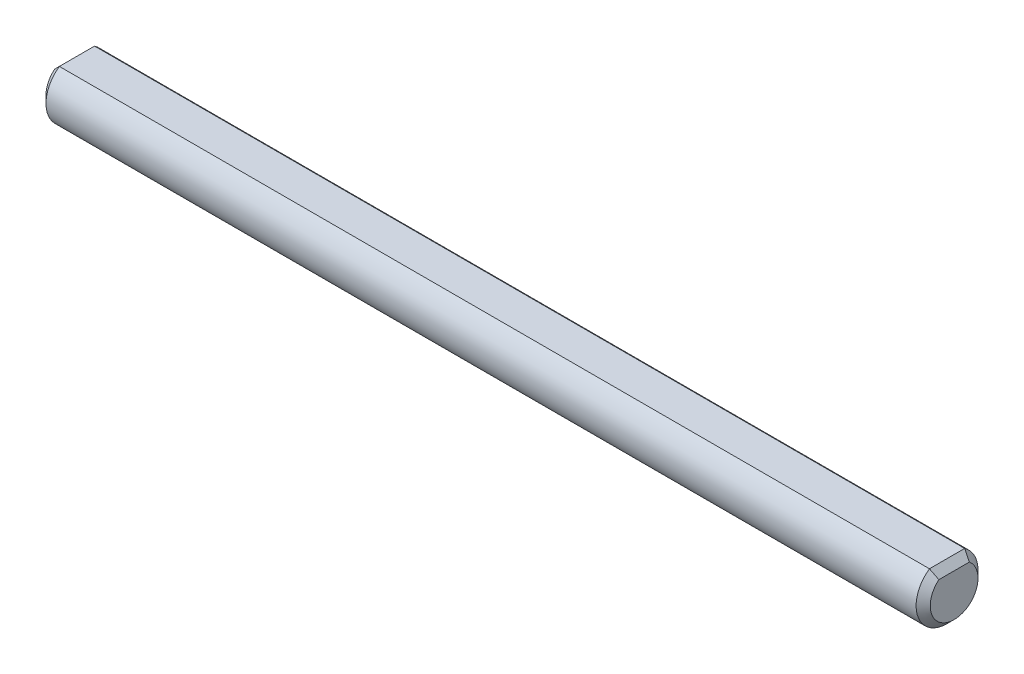
from build123d import *

# Parameters (mm, degrees)
BOSS_EXTRUDE1_DEPTH = 25
CHAMFER1_SIZE       = 0.4


with BuildPart() as part:
    # Sketch1 → Boss-Extrude1 (new, symmetric)
    with BuildSketch(Plane(origin=(0, 0, 0), x_dir=(0, 0, -1), z_dir=(1, 0, 0))):
        with BuildLine():
            Line((0.995546671, 1.439231331), (-0.995546671, 1.439231331))
            ThreePointArc((-0.995546671, 1.439231331), (0, -1.75), (0.995546671, 1.439231331))
        make_face()
    extrude(amount=BOSS_EXTRUDE1_DEPTH, both=True)

    # Chamfer1
    # the kernel refuses this chamfer: 0.4 mm, written as the material it takes off along each edge
    with BuildSketch(Plane(origin=(-25, 1.439231331, -2.024219866), x_dir=(0.9996219169112966, 0.02749587661058634, 0), z_dir=(0, 0, 1))) as chamfer1_piece_1:
        Polygon((CHAMFER1_SIZE * 0.999621916911, -CHAMFER1_SIZE * 0.0274958766106), (-CHAMFER1_SIZE * 0.0274958766106, -CHAMFER1_SIZE * 0.999621916911), (0, 0), align=None)
    extrude(amount=4.048439733, mode=Mode.SUBTRACT)
    with BuildSketch(Plane(origin=(-25, 0, 0), x_dir=(0, 0.9998895110785412, 0.014864912886252453), z_dir=(0, 0.014864912886252453, -0.9998895110785412))) as chamfer1_piece_2:
        Polygon((1.75, CHAMFER1_SIZE), (1.75 - CHAMFER1_SIZE, 0), (1.75, 0), align=None)
    revolve(axis=Axis((-25, 0, 0), (1, 0, 0)), revolution_arc=358.296543719, mode=Mode.SUBTRACT)
    with BuildSketch(Plane(origin=(25, 0, 0), x_dir=(0, 0.9998895110785412, 0.014864912886252453), z_dir=(0, 0.014864912886252453, -0.9998895110785412))) as chamfer1_piece_3:
        Polygon((1.75 - CHAMFER1_SIZE, 0), (1.75, -CHAMFER1_SIZE), (1.75, 0), align=None)
    revolve(axis=Axis((25, 0, 0), (1, 0, 0)), revolution_arc=358.296543719, mode=Mode.SUBTRACT)
    with BuildSketch(Plane(origin=(25, 1.439231331, -2.024219866), x_dir=(-0.9996219169112966, 0.02749587661058634, 0), z_dir=(0, 0, 1))) as chamfer1_piece_4:
        Polygon((CHAMFER1_SIZE * 0.999621916911, CHAMFER1_SIZE * 0.0274958766106), (-CHAMFER1_SIZE * 0.0274958766106, CHAMFER1_SIZE * 0.999621916911), (0, 0), align=None)
    extrude(amount=4.048439733, mode=Mode.SUBTRACT)


solid = part.part
